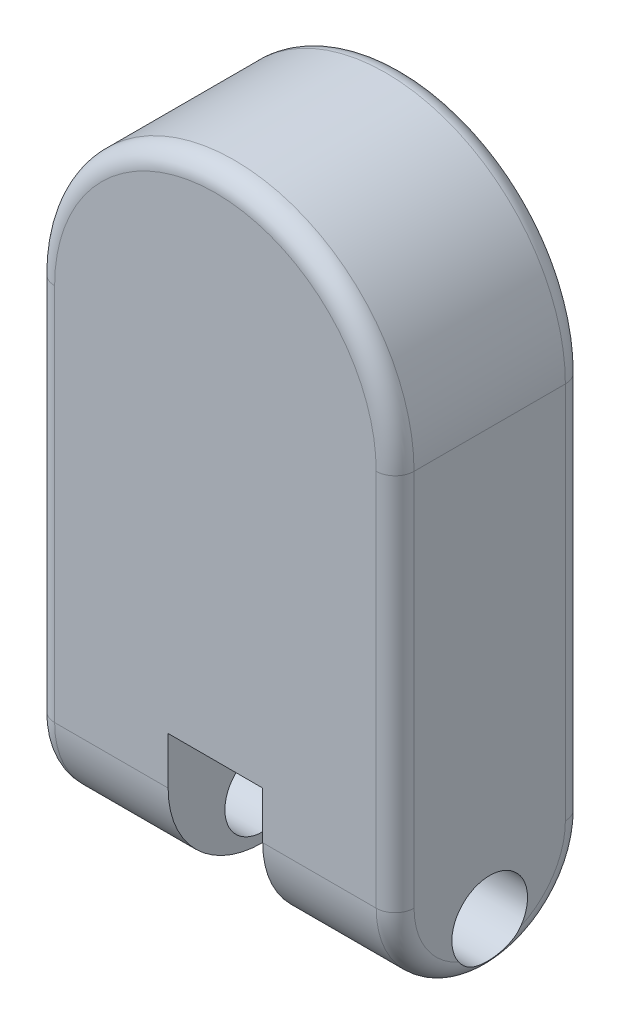
from build123d import *

# Parameters (mm, degrees)
BOSS_EXTRUDE1_DEPTH    = 100
SKETCH2_W              = 50
SKETCH2_H              = 50
CUT_EXTRUDE1_DEPTH     = 187.14510469
CUT_EXTRUDE2_DEPTH     = 25
SKETCH7_R              = 20
CUT_EXTRUDE3_DEPTH     = 249.445164976
FILLET2_R              = 50
CUT_EXTRUDE6_START     = -125
CUT_EXTRUDE6_OUTLINE_W = 50
CUT_EXTRUDE6_OUTLINE_H = 6.698729811
CUT_EXTRUDE6_DEPTH     = 50
CUT_EXTRUDE7_DEPTH     = 25
BOSS_EXTRUDE2_DEPTH    = 100
FILLET4_R              = 10
SKETCH11_W             = 50
SKETCH11_H             = 25
CUT_EXTRUDE11_DEPTH    = 99
SKETCH16_W             = 50
SKETCH16_H             = 30
BOSS_EXTRUDE3_DEPTH    = 0.1
FILLET5_R              = 10


with BuildPart() as part:
    # Sketch1 → Boss-Extrude1 (new body)
    with BuildSketch(Plane.XY):
        Polygon((-95, 125), (20.2, 125), (69.8, 125), (95, 125), (95, -125), (-95, -125), align=None)
    extrude(amount=-BOSS_EXTRUDE1_DEPTH)

    # Sketch2 → Cut-Extrude1 (cut, through all)
    with BuildSketch(Plane.XY):
        with Locations((0, -125)):
            Rectangle(SKETCH2_W, SKETCH2_H)
    extrude(amount=-CUT_EXTRUDE1_DEPTH, mode=Mode.SUBTRACT)

    # Sketch6 → Cut-Extrude2 (cut, symmetric)
    with BuildSketch(Plane(origin=(0, 0, 0), x_dir=(0, 0, -1), z_dir=(1, 0, 0))):
        with BuildLine():
            Line((100, -100), (0, -100))
            ThreePointArc((0, -100), (50, -50), (100, -100))
        make_face()
    extrude(amount=CUT_EXTRUDE2_DEPTH, both=True, mode=Mode.SUBTRACT)

    # Sketch7 → Cut-Extrude3 (cut, through all)
    with BuildSketch(Plane.ZY.offset(95)):
        with Locations(Location((-50, -100, 0), (0, 0, 270))):
            Circle(SKETCH7_R)
    extrude(amount=-CUT_EXTRUDE3_DEPTH, mode=Mode.SUBTRACT)

    # Fillet2
    fillet2_edges = [part.edges().sort_by_distance(p)[0] for p in [
        (-60, -125, -100),
        (-60, -125, 0),
    ]]
    fillet(fillet2_edges, radius=FILLET2_R - 0.0001)  # a hair under: the kernel refuses the full size

    # Cut-Extrude6: read off the stored shape, not the designer's step
    # Cut-Extrude6 outline → Cut-Extrude6 (cut)
    with BuildSketch(Plane(origin=(0, 0, 0), x_dir=(1, 0, 0), z_dir=(0, 1, 0)).offset(CUT_EXTRUDE6_START)):
        with Locations((0, 96.650635095)):
            Rectangle(CUT_EXTRUDE6_OUTLINE_W, CUT_EXTRUDE6_OUTLINE_H)
        with Locations((0, 3.349364906)):
            Rectangle(CUT_EXTRUDE6_OUTLINE_W, CUT_EXTRUDE6_OUTLINE_H)
    extrude(amount=CUT_EXTRUDE6_DEPTH, mode=Mode.SUBTRACT)

    # Sketch10 → Cut-Extrude7 (cut, symmetric)
    with BuildSketch(Plane(origin=(0, 0, 0), x_dir=(0, 0, -1), z_dir=(1, 0, 0))):
        with BuildLine():
            Line((0, -75), (100, -75))
            ThreePointArc((100, -75), (50, -61.602540378), (0, -75))
        make_face()
    extrude(amount=CUT_EXTRUDE7_DEPTH, both=True, mode=Mode.SUBTRACT)

    # Sketch15 → Boss-Extrude2 (add)
    with BuildSketch(Plane.XY):
        with BuildLine():
            Line((-95, 125), (95, 125))
            ThreePointArc((95, 125), (0, 220), (-95, 125))
        make_face()
    extrude(amount=-BOSS_EXTRUDE2_DEPTH)

    # Fillet4
    # the kernel refuses this fillet: 10 mm, written as the material it takes off along each edge
    with BuildSketch(Plane(origin=(0, 125, -100), x_dir=(1, 0, 0), z_dir=(0, -1, 0))) as fillet4_piece_1:
        with BuildLine():
            CenterArc((95 - FILLET4_R, FILLET4_R), FILLET4_R, 270, 90)
            Line((95, FILLET4_R), (95, 0))
            Line((95, 0), (95 - FILLET4_R, 0))
        make_face()
    revolve(axis=Axis((0, 125, -100), (0, 0, 1)), revolution_arc=180, mode=Mode.SUBTRACT)
    with BuildSketch(Plane(origin=(0, 125, 0), x_dir=(1, 0, 0), z_dir=(0, -1, 0))) as fillet4_piece_2:
        with BuildLine():
            CenterArc((95 - FILLET4_R, -FILLET4_R), FILLET4_R, 0, 90)
            Line((95, -FILLET4_R), (95, 0))
            Line((95, 0), (95 - FILLET4_R, 0))
        make_face()
    revolve(axis=Axis((0, 125, 0), (0, 0, 1)), revolution_arc=180, mode=Mode.SUBTRACT)
    with BuildSketch(Plane(origin=(-95, -75.0001, -100), x_dir=(0, 0, 1), z_dir=(0, 1, 0)), Plane(origin=(95, 125, 0), x_dir=(-1, 0, 0), z_dir=(0, -1, 0))) as fillet4_piece_3:
        with BuildLine():
            CenterArc((FILLET4_R, FILLET4_R), FILLET4_R, 180, 90)
            Line((0, FILLET4_R), (0, 0))
            Line((0, 0), (FILLET4_R, 0))
        make_face()
    extrude(amount=200.0001, mode=Mode.SUBTRACT)
    with BuildSketch(Plane(origin=(95, 125, -100), x_dir=(-1, 0, 0), z_dir=(0, -1, 0)), Plane(origin=(-95, -75.0001, 0), x_dir=(0, 0, -1), z_dir=(0, 1, 0))) as fillet4_piece_4:
        with BuildLine():
            CenterArc((FILLET4_R, -FILLET4_R), FILLET4_R, 90, 90)
            Line((0, -FILLET4_R), (0, 0))
            Line((0, 0), (FILLET4_R, 0))
        make_face()
    extrude(amount=200.0001, mode=Mode.SUBTRACT)
    with BuildSketch(Plane(origin=(95, -75.0001, -49.9999), x_dir=(0, 0, 1), z_dir=(0, 1, 0))) as fillet4_piece_5:
        with BuildLine():
            CenterArc((49.9999 - FILLET4_R, -FILLET4_R), FILLET4_R, 0, 90)
            Line((49.9999 - FILLET4_R, 0), (49.9999, 0))
            Line((49.9999, 0), (49.9999, -FILLET4_R))
        make_face()
    revolve(axis=Axis((95, -75.0001, -49.9999), (1, 0, 0)), revolution_arc=90, mode=Mode.SUBTRACT)
    with BuildSketch(Plane(origin=(95, -75.0001, -50.0001), x_dir=(0, 0, -1), z_dir=(0, 1, 0))) as fillet4_piece_6:
        with BuildLine():
            CenterArc((49.9999 - FILLET4_R, FILLET4_R), FILLET4_R, 270, 90)
            Line((49.9999, FILLET4_R), (49.9999, 0))
            Line((49.9999, 0), (49.9999 - FILLET4_R, 0))
        make_face()
    revolve(axis=Axis((95, -75.0001, -50.0001), (-1, 0, 0)), revolution_arc=90, mode=Mode.SUBTRACT)
    with BuildSketch(Plane(origin=(-95, -75.0001, -49.9999), x_dir=(0, 0, 1), z_dir=(0, 1, 0))) as fillet4_piece_7:
        with BuildLine():
            CenterArc((49.9999 - FILLET4_R, FILLET4_R), FILLET4_R, 270, 90)
            Line((49.9999, FILLET4_R), (49.9999, 0))
            Line((49.9999, 0), (49.9999 - FILLET4_R, 0))
        make_face()
    revolve(axis=Axis((-95, -75.0001, -49.9999), (1, 0, 0)), revolution_arc=90, mode=Mode.SUBTRACT)
    with BuildSketch(Plane(origin=(-95, -75.0001, -50.0001), x_dir=(0, 0, -1), z_dir=(0, 1, 0))) as fillet4_piece_8:
        with BuildLine():
            CenterArc((49.9999 - FILLET4_R, -FILLET4_R), FILLET4_R, 0, 90)
            Line((49.9999, -FILLET4_R), (49.9999, 0))
            Line((49.9999, 0), (49.9999 - FILLET4_R, 0))
        make_face()
    revolve(axis=Axis((-95, -75.0001, -50.0001), (-1, 0, 0)), revolution_arc=90, mode=Mode.SUBTRACT)
    with BuildSketch(Plane(origin=(-95, -125, -49.9999), x_dir=(0, 1, 0), z_dir=(0, 0, -1))) as fillet4_piece_9:
        with BuildLine():
            CenterArc((FILLET4_R, FILLET4_R), FILLET4_R, 180, 90)
            Line((0, FILLET4_R), (0, 0))
            Line((0, 0), (FILLET4_R, 0))
        make_face()
    extrude(amount=0.0002, mode=Mode.SUBTRACT)
    with BuildSketch(Plane(origin=(95, -125, -49.9999), x_dir=(0, 1, 0), z_dir=(0, 0, -1))) as fillet4_piece_10:
        with BuildLine():
            CenterArc((FILLET4_R, -FILLET4_R), FILLET4_R, 90, 90)
            Line((0, -FILLET4_R), (0, 0))
            Line((0, 0), (FILLET4_R, 0))
        make_face()
    extrude(amount=0.0002, mode=Mode.SUBTRACT)

    # Sketch11 → Cut-Extrude11 (cut)
    with BuildSketch(Plane.XY):
        with Locations((0, -62.5)):
            Rectangle(SKETCH11_W, SKETCH11_H)
    extrude(amount=-CUT_EXTRUDE11_DEPTH, mode=Mode.SUBTRACT)


with BuildPart() as body_2:
    # Sketch16 → Boss-Extrude3 (new body)
    with BuildSketch(Plane(origin=(0, 0, -100), x_dir=(-1, 0, 0), z_dir=(0, 0, -1))):
        with Locations((0, -90)):
            Rectangle(SKETCH16_W, SKETCH16_H)
    extrude(amount=BOSS_EXTRUDE3_DEPTH)

    # Fillet5
    # the kernel refuses this fillet: 10 mm, written as the material it takes off along each edge
    with BuildSketch(Plane(origin=(25, -71.473316005, -100.1), x_dir=(0, 0, 1), z_dir=(0, -1, 0)), Plane(origin=(-25, -108.526683995, -100.1), x_dir=(0, 0, 1), z_dir=(0, 1, 0))) as fillet5_piece_1:
        with BuildLine():
            CenterArc((10, 1.410673598), FILLET5_R, 180, 8.109614456)
            Line((0, 1.410673598), (0, 0))
            Line((0, 0), (0.1, 0))
        make_face()
    extrude(amount=37.05336799, mode=Mode.SUBTRACT)
    with BuildSketch(Plane(origin=(28.526683995, -105, -100.1), x_dir=(0, 0, 1), z_dir=(-1, 0, 0))) as fillet5_piece_2:
        with BuildLine():
            CenterArc((10, 1.410673598), FILLET5_R, 180, 8.109614456)
            Line((0, 1.410673598), (0, 0))
            Line((0, 0), (0.1, 0))
        make_face()
    extrude(amount=57.05336799, mode=Mode.SUBTRACT)


solid = Compound([part.part, body_2.part])
